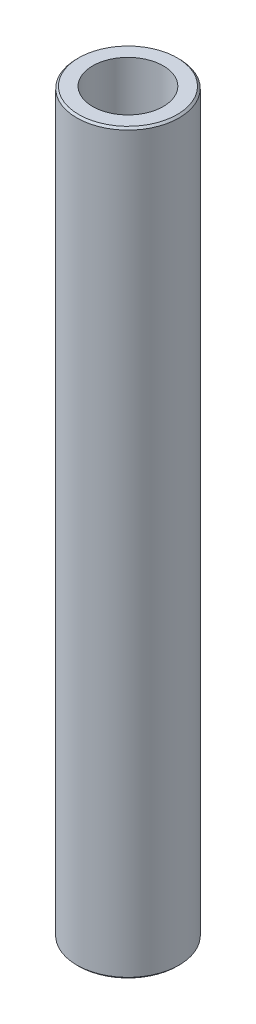
from build123d import *

# Parameters (mm, degrees)
SKETCH1_R           = 22.5
BOSS_EXTRUDE1_DEPTH = 324.558327516
SKETCH2_R           = 15.534633055
CUT_EXTRUDE1_DEPTH  = 327.114409311
CHAMFER1_SIZE       = 0.852970981


with BuildPart() as part:
    # Sketch1 → Boss-Extrude1 (new body)
    with BuildSketch(Plane(origin=(0, 0, 0), x_dir=(1, 0, 0), z_dir=(0, 1, 0))):
        Circle(SKETCH1_R)
    extrude(amount=BOSS_EXTRUDE1_DEPTH)

    # Sketch2 → Cut-Extrude1 (cut, through all)
    with BuildSketch(Plane(origin=(0, 0, 0), x_dir=(1, 0, 0), z_dir=(0, 1, 0))):
        Circle(SKETCH2_R)
    extrude(amount=CUT_EXTRUDE1_DEPTH, mode=Mode.SUBTRACT)

    # Chamfer1
    chamfer1_edges = [part.edges().sort_by_distance(p)[0] for p in [
        (-22.5, 324.558327516, 0),
        (-22.5, 0, 0),
    ]]
    chamfer(chamfer1_edges, length=CHAMFER1_SIZE)


solid = part.part
